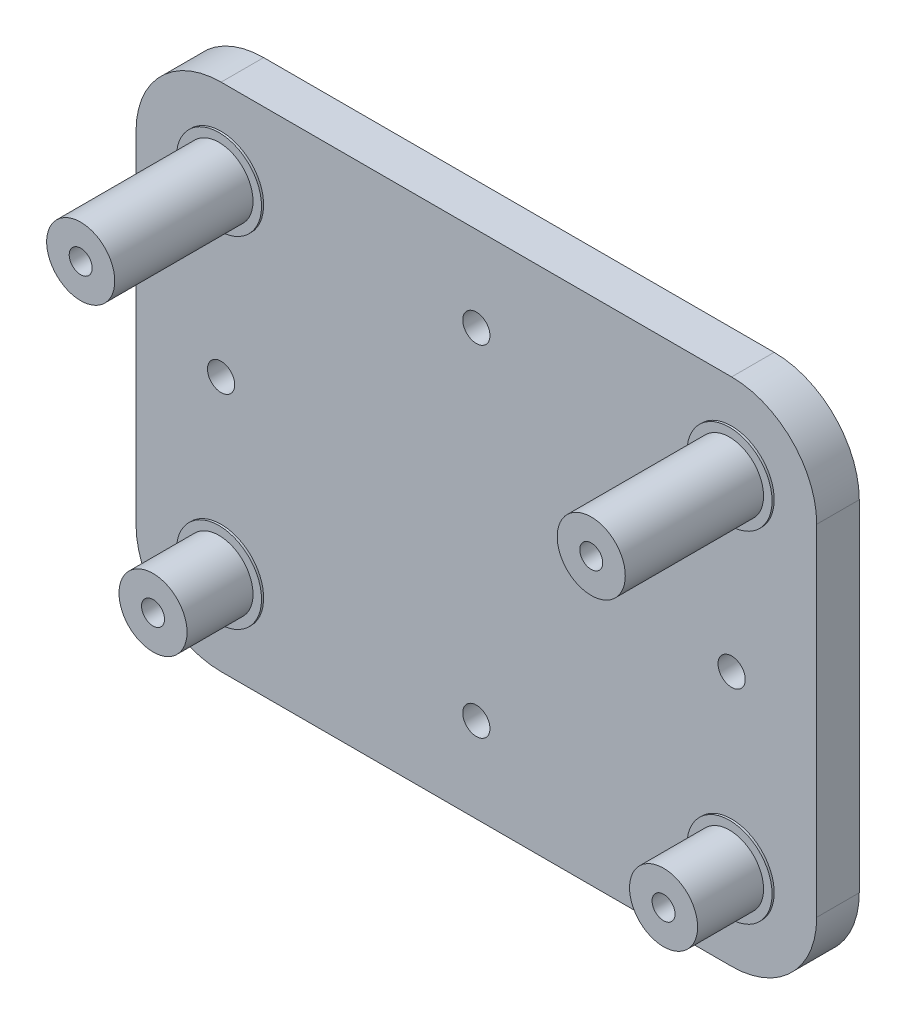
from build123d import *

# Parameters (mm, degrees)
SKETCH1_W               = 80
SKETCH1_H               = 60
BOSS_EXTRUDE1_DEPTH     = 5
SKETCH1_3_R             = 4
SKETCH1_3_R_2           = 1.35
BOSS_EXTRUDE2_DEPTH     = 8
SKETCH1_5_R             = 4
SKETCH1_5_R_2           = 1.35
BOSS_EXTRUDE4_DEPTH     = 16.5
SKETCH1_4_R             = 5
SKETCH1_4_R_2           = 4
BOSS_EXTRUDE3_DEPTH     = 0.25
CUT_EXTRUDE1_DEPTH      = 53.65216045
CUT_EXTRUDE1_DEPTH_BACK = 53.65216045
SKETCH1_6_R             = 1.6
FILLET1_R               = 10


with BuildPart() as part:
    # Sketch1 → Boss-Extrude1 (new body)
    with BuildSketch(Plane.XY):
        Rectangle(SKETCH1_W, SKETCH1_H)
    extrude(amount=-BOSS_EXTRUDE1_DEPTH)

    # Sketch1<3> → Boss-Extrude2 (add)
    # profile 1 of 2: a face of its own
    with BuildSketch(Plane.XY):
        with Locations((-30, -20)):
            Circle(SKETCH1_3_R)
        with Locations((-30, -20)):
            Circle(SKETCH1_3_R_2, mode=Mode.SUBTRACT)
    # profile 2 of 2: a face of its own
    with BuildSketch(Plane.XY):
        with Locations((30, -20)):
            Circle(SKETCH1_3_R)
        with Locations((30, -20)):
            Circle(SKETCH1_3_R_2, mode=Mode.SUBTRACT)
    extrude(amount=BOSS_EXTRUDE2_DEPTH)

    # Sketch1<5> → Boss-Extrude4 (add)
    # profile 1 of 2: a face of its own
    with BuildSketch(Plane.XY):
        with Locations((-30, 20)):
            Circle(SKETCH1_5_R)
        with Locations((-30, 20)):
            Circle(SKETCH1_5_R_2, mode=Mode.SUBTRACT)
    # profile 2 of 2: a face of its own
    with BuildSketch(Plane.XY):
        with Locations((30, 20)):
            Circle(SKETCH1_5_R)
        with Locations((30, 20)):
            Circle(SKETCH1_5_R_2, mode=Mode.SUBTRACT)
    extrude(amount=BOSS_EXTRUDE4_DEPTH)

    # Sketch1<4> → Boss-Extrude3 (add)
    # profile 1 of 4: a face of its own
    with BuildSketch(Plane.XY):
        with Locations((-30, 20)):
            Circle(SKETCH1_4_R)
        with Locations((-30, 20)):
            Circle(SKETCH1_4_R_2, mode=Mode.SUBTRACT)
    # profile 2 of 4: a face of its own
    with BuildSketch(Plane.XY):
        with Locations((30, 20)):
            Circle(SKETCH1_4_R)
        with Locations((30, 20)):
            Circle(SKETCH1_4_R_2, mode=Mode.SUBTRACT)
    # profile 3 of 4: a face of its own
    with BuildSketch(Plane.XY):
        with Locations((30, -20)):
            Circle(SKETCH1_4_R)
        with Locations((30, -20)):
            Circle(SKETCH1_4_R_2, mode=Mode.SUBTRACT)
    # profile 4 of 4: a face of its own
    with BuildSketch(Plane.XY):
        with Locations((-30, -20)):
            Circle(SKETCH1_4_R)
        with Locations((-30, -20)):
            Circle(SKETCH1_4_R_2, mode=Mode.SUBTRACT)
    extrude(amount=BOSS_EXTRUDE3_DEPTH)

    # Sketch1<6> → Cut-Extrude1 (cut, two sides: drawn at the far end of the back side and taken through both)
    with BuildSketch(Plane.XY.offset(-CUT_EXTRUDE1_DEPTH_BACK)):
        with Locations((-30, 0)):
            Circle(SKETCH1_6_R)
        with Locations((0, 20)):
            Circle(SKETCH1_6_R)
        with Locations((30, 0)):
            Circle(SKETCH1_6_R)
        with Locations((0, -20)):
            Circle(SKETCH1_6_R)
    extrude(amount=CUT_EXTRUDE1_DEPTH + CUT_EXTRUDE1_DEPTH_BACK, mode=Mode.SUBTRACT)

    # Fillet1
    fillet1_edges = [part.edges().sort_by_distance(p)[0] for p in [
        (40, 30, -2.5),
        (40, -30, -2.5),
        (-40, -30, -2.5),
        (-40, 30, -2.5),
    ]]
    fillet(fillet1_edges, radius=FILLET1_R)


solid = part.part
